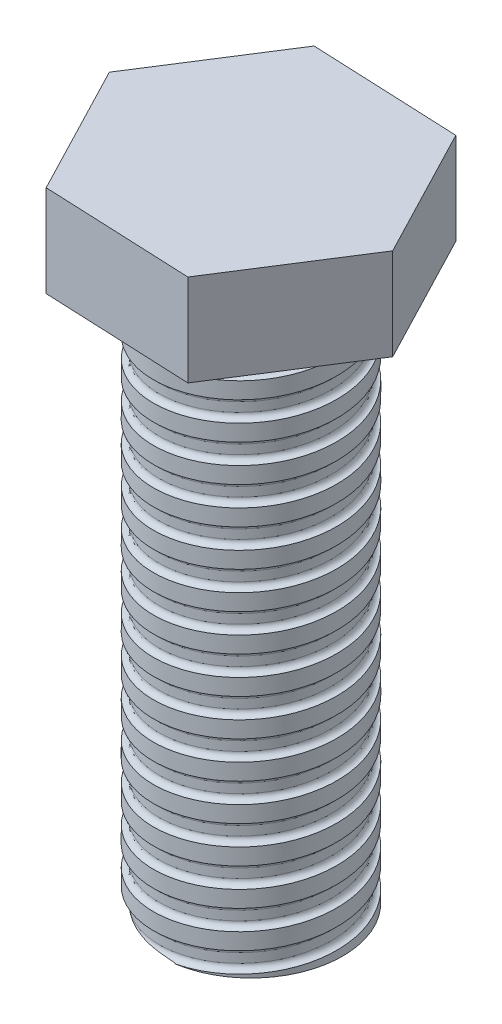
from build123d import *

# Parameters (mm, degrees)
SKETCH1_R           = 5
BOSS_EXTRUDE1_DEPTH = 30
BOSS_EXTRUDE2_DEPTH = 5
CUT_SWEEP2_PITCH    = 2
CUT_SWEEP2_TO       = 30


with BuildPart() as part:
    # Sketch1 → Boss-Extrude1 (new body)
    with BuildSketch(Plane(origin=(0, 0, 0), x_dir=(1, 0, 0), z_dir=(0, 1, 0))):
        with Locations(Location((0, 0, 0), (0, 0, 270))):
            Circle(SKETCH1_R)
    extrude(amount=BOSS_EXTRUDE1_DEPTH)

    # Sketch2 → Boss-Extrude2 (add)
    with BuildSketch(Plane(origin=(0, 30, 0), x_dir=(1, 0, 0), z_dir=(0, 1, 0))):
        Polygon((-4.344358491, -6.816148666), (3.730778656, -7.170399149), (8.075137146, -0.354250483), (4.344358491, 6.816148666), (-3.730778656, 7.170399149), (-8.075137146, 0.354250483), align=None)
    extrude(amount=BOSS_EXTRUDE2_DEPTH)

    # Cut-Sweep2: arcs per turn and ends read off the stored shape
    # Cut-Sweep2: the profile of Sketch4 screwed along a right-hand helix through 16.6 turns, 10 arcs to a turn; built about Z, then put on its axis
    cut_sweep2_z = Axis((0, 0, 0), (0, 0, 1))
    cut_sweep2_corners = [(5.3, 0.01588334, -2.249494929), (5.3, -0.01588334, -1.750505071), (5, -0.034943349, -1.451111157), (4.7, -0.01588334, -1.750505071), (4.7, 0.01588334, -2.249494929), (5, 0.034943349, -2.548888843)]
    with BuildLine(mode=Mode.PRIVATE) as cut_sweep2_profile:
        Line(cut_sweep2_corners[0], cut_sweep2_corners[1])
        Line(cut_sweep2_corners[3], cut_sweep2_corners[4])
        ThreePointArc((5.3, -0.01588334, -1.750505071), (5.212132034, -0.029360802, -1.538801604), (5, -0.034943349, -1.451111157))
        ThreePointArc((5, -0.034943349, -1.451111157), (4.787867966, -0.029360802, -1.538801604), (4.7, -0.01588334, -1.750505071))
        ThreePointArc((4.7, 0.01588334, -2.249494929), (4.787867966, 0.029360802, -2.461198396), (5, 0.034943349, -2.548888843))
        ThreePointArc((5, 0.034943349, -2.548888843), (5.212132034, 0.029360802, -2.461198396), (5.3, 0.01588334, -2.249494929))
    cut_sweep2_cap = Face(cut_sweep2_profile.wire())
    cut_sweep2_arcs = [((5.3, -0.01588334, -1.750505071), (5.3, -0.034943349, -1.451111157), (5, -0.034943349, -1.451111157), (1, 0.7071067811865476, 1)), ((5, -0.034943349, -1.451111157), (4.7, -0.034943349, -1.451111157), (4.7, -0.01588334, -1.750505071), (1, 0.7071067811865476, 1)), ((4.7, 0.01588334, -2.249494929), (4.7, 0.034943349, -2.548888843), (5, 0.034943349, -2.548888843), (1, 0.7071067811865476, 1)), ((5, 0.034943349, -2.548888843), (5.3, 0.034943349, -2.548888843), (5.3, 0.01588334, -2.249494929), (1, 0.7071067811865476, 1))]  # start, shoulder, end, weights
    cut_sweep2_turn_angles = [0, 18, 36, 54, 72, 90, 108, 126, 144, 162, 180, 198, 216, 234, 252, 270, 288, 306, 324, 342, 360]
    cut_sweep2_turn_weights = [1, 0.9510565162951535, 1, 0.9510565162951535, 1, 0.9510565162951535, 1, 0.9510565162951535, 1, 0.9510565162951535, 1, 0.9510565162951535, 1, 0.9510565162951535, 1, 0.9510565162951535, 1, 0.9510565162951535, 1, 0.9510565162951535, 1]
    cut_sweep2_turn_rails = [Edge.make_bspline([Vector(p[0], p[1], 0).rotate(cut_sweep2_z, cut_sweep2_turn_angles[k]) / cut_sweep2_turn_weights[k] + Vector(0, 0, p[2] + CUT_SWEEP2_PITCH * cut_sweep2_turn_angles[k] / 360) for k in range(21)], [0, 0, 0, 1, 1, 2, 2, 3, 3, 4, 4, 5, 5, 6, 6, 7, 7, 8, 8, 9, 9, 10, 10, 10], 2, cut_sweep2_turn_weights) for p in cut_sweep2_corners]
    cut_sweep2_turn_sides = [*[Face.make_surface_from_curves(cut_sweep2_turn_rails[p[0]], cut_sweep2_turn_rails[p[1]]) for p in [(0, 1), (3, 4)]], *[Face.make_bezier_surface([[Vector(p[j][0], p[j][1], 0).rotate(cut_sweep2_z, cut_sweep2_turn_angles[2 * i + k]) / cut_sweep2_turn_weights[2 * i + k] + Vector(0, 0, p[j][2] + CUT_SWEEP2_PITCH * cut_sweep2_turn_angles[2 * i + k] / 360) for k in range(3)] for j in range(3)], [[p[3][j] * cut_sweep2_turn_weights[2 * i + k] for k in range(3)] for j in range(3)]) for p in cut_sweep2_arcs for i in range(10)]]
    cut_sweep2_last_angles = [5760, 5778, 5796, 5814, 5832, 5850, 5868, 5886, 5904, 5922, 5940, 5958, 5976]
    cut_sweep2_last_weights = [1, 0.9510565162951535, 1, 0.9510565162951535, 1, 0.9510565162951535, 1, 0.9510565162951535, 1, 0.9510565162951535, 1, 0.9510565162951535, 1]
    cut_sweep2_last_rails = [Edge.make_bspline([Vector(p[0], p[1], 0).rotate(cut_sweep2_z, cut_sweep2_last_angles[k]) / cut_sweep2_last_weights[k] + Vector(0, 0, p[2] + CUT_SWEEP2_PITCH * cut_sweep2_last_angles[k] / 360) for k in range(13)], [0, 0, 0, 1, 1, 2, 2, 3, 3, 4, 4, 5, 5, 6, 6, 6], 2, cut_sweep2_last_weights) for p in cut_sweep2_corners]
    cut_sweep2_last_sides = [*[Face.make_surface_from_curves(cut_sweep2_last_rails[p[0]], cut_sweep2_last_rails[p[1]]) for p in [(0, 1), (3, 4)]], *[Face.make_bezier_surface([[Vector(p[j][0], p[j][1], 0).rotate(cut_sweep2_z, cut_sweep2_last_angles[2 * i + k]) / cut_sweep2_last_weights[2 * i + k] + Vector(0, 0, p[j][2] + CUT_SWEEP2_PITCH * cut_sweep2_last_angles[2 * i + k] / 360) for k in range(3)] for j in range(3)], [[p[3][j] * cut_sweep2_last_weights[2 * i + k] for k in range(3)] for j in range(3)]) for p in cut_sweep2_arcs for i in range(6)]]
    cut_sweep2 = Plane(origin=(0, 0, 0), x_dir=(-1, 0, 0), z_dir=(0, 1, 0)) * split(Solid(Shell([*[p.moved(Location((0, 0, CUT_SWEEP2_PITCH * i))) for i in range(16) for p in cut_sweep2_turn_sides], *cut_sweep2_last_sides, cut_sweep2_cap, cut_sweep2_cap.rotate(cut_sweep2_z, 5976).moved(Location((0, 0, CUT_SWEEP2_PITCH * 5976 / 360)))])), bisect_by=Plane.XY.offset(CUT_SWEEP2_TO), keep=Keep.BOTTOM, mode=Mode.PRIVATE)
    add(cut_sweep2, mode=Mode.SUBTRACT)


solid = part.part
